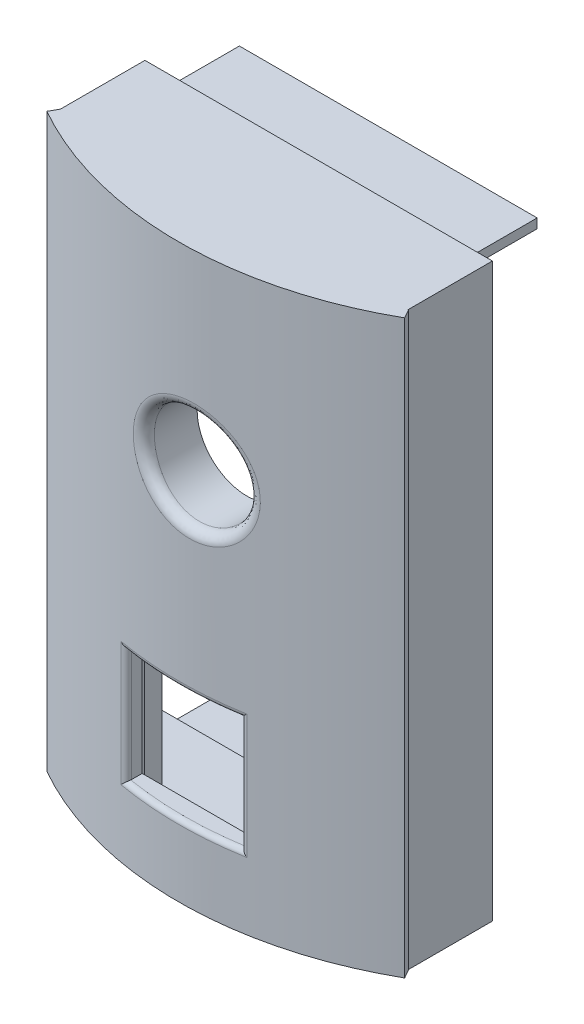
from build123d import *

# Parameters (mm, degrees)
SURFACE_EXTRUDE2_1_DEPTH = 115
THICKEN3_T2              = 2
BOSS_EXTRUDE2_REACH      = 890.669
SKETCH11_W               = 70
SKETCH11_H               = 115
SKETCH17_W               = 2.5
SKETCH17_H               = 115
BOSS_EXTRUDE8_DEPTH      = 17
SKETCH22_W               = 59.9
SKETCH22_H               = 1.9
BOSS_EXTRUDE9_DEPTH      = 31
SKETCH23_W               = 64.9
SKETCH23_H               = 2
BOSS_EXTRUDE10_DEPTH     = 17
SKETCH24_W               = 64.9
SKETCH24_H               = 3.5
BOSS_EXTRUDE11_DEPTH     = 17
SKETCH25_W               = 19
SKETCH25_H               = 1.3
BOSS_EXTRUDE12_DEPTH     = 14
SKETCH26_W               = 2.5
SKETCH26_H               = 55
CUT_EXTRUDE1_DEPTH       = 2.5
FILLET1_R                = 1
CUT_EXTRUDE2_REACH       = 891.139
CUT_EXTRUDE2_END_RADIUS  = 73
SKETCH27_R               = 10
CUT_EXTRUDE3_REACH       = 891.139
CUT_EXTRUDE3_END_RADIUS  = 73
SKETCH28_W               = 23
SKETCH28_H               = 23
SKETCH29_W               = 26
SKETCH29_H               = 34
CUT_EXTRUDE4_DEPTH       = 7
SKETCH30_W               = 29
SKETCH30_H               = 37
CUT_EXTRUDE5_DEPTH       = 5
FILLET2_R                = 2
FILLET4_R                = 1


with BuildPart() as body_1:
    # Surface-Extrude2: a surface, the sketch's curves swept straight by 115 mm
    with BuildLine(Plane(origin=(0, 0, 0), x_dir=(1, 0, 0), z_dir=(0, 1, 0)), mode=Mode.PRIVATE) as surface_extrude2_1_path:
        ThreePointArc((-880.139667207, 63.554736355), (-845.139667207, 54.328517201), (-810.139667207, 63.554736355))
    surface_extrude2_1 = Shell.extrude(surface_extrude2_1_path.wire(), (0 * SURFACE_EXTRUDE2_1_DEPTH, 1 * SURFACE_EXTRUDE2_1_DEPTH, 0 * SURFACE_EXTRUDE2_1_DEPTH))
    add(Solid.thicken(surface_extrude2_1, -THICKEN3_T2))

    # Sketch11 → Boss-Extrude2 (add, up to next)
    with BuildSketch(Plane(origin=(0, 0, -63.554736355), x_dir=(-1, 0, 0), z_dir=(0, 0, -1)), mode=Mode.PRIVATE) as boss_extrude2_sk1:
        with Locations((845.139667207, 57.5)):
            Rectangle(SKETCH11_W, SKETCH11_H)
    boss_extrude2_tool1 = extrude(boss_extrude2_sk1.sketch, amount=-BOSS_EXTRUDE2_REACH, mode=Mode.PRIVATE) - body_1.part
    add(boss_extrude2_tool1.solids().sort_by_distance((-845.139667, 57.5, -63.554736))[0])

    # Sketch17 → Boss-Extrude8 (add)
    with BuildSketch(Plane(origin=(0, 0, -63.554736355), x_dir=(-1, 0, 0), z_dir=(0, 0, -1))):
        with Locations((878.889667207, 57.5)):
            Rectangle(SKETCH17_W, SKETCH17_H)
        with Locations((811.489667207, 57.5)):
            Rectangle(SKETCH17_W, SKETCH17_H)
    extrude(amount=BOSS_EXTRUDE8_DEPTH)

    # Sketch22 → Boss-Extrude9 (add)
    with BuildSketch(Plane(origin=(0, 0, -63.554736355), x_dir=(-1, 0, 0), z_dir=(0, 0, -1))):
        with Locations((845.189667207, 112.05)):
            Rectangle(SKETCH22_W, SKETCH22_H)
    extrude(amount=BOSS_EXTRUDE9_DEPTH)

    # Sketch23 → Boss-Extrude10 (add)
    with BuildSketch(Plane(origin=(0, 0, -63.554736355), x_dir=(-1, 0, 0), z_dir=(0, 0, -1))):
        with Locations((845.189667207, 114)):
            Rectangle(SKETCH23_W, SKETCH23_H)
    extrude(amount=BOSS_EXTRUDE10_DEPTH)

    # Sketch24 → Boss-Extrude11 (add)
    with BuildSketch(Plane(origin=(0, 0, -63.554736355), x_dir=(-1, 0, 0), z_dir=(0, 0, -1))):
        with Locations((845.189667207, 1.75)):
            Rectangle(SKETCH24_W, SKETCH24_H)
    extrude(amount=BOSS_EXTRUDE11_DEPTH)

    # Sketch25 → Boss-Extrude12 (add)
    with BuildSketch(Plane(origin=(0, 0, -80.554736355), x_dir=(-1, 0, 0), z_dir=(0, 0, -1))):
        with Locations((865.139667207, 1.85)):
            Rectangle(SKETCH25_W, SKETCH25_H)
    extrude(amount=BOSS_EXTRUDE12_DEPTH)

    # Sketch26 → Cut-Extrude1 (cut)
    with BuildSketch(Plane.ZY.offset(880.139667207)):
        with Locations((-79.304736355, 35.5)):
            Rectangle(SKETCH26_W, SKETCH26_H)
    extrude(amount=-CUT_EXTRUDE1_DEPTH, mode=Mode.SUBTRACT)

    # Fillet1
    fillet1_edges = [body_1.edges().sort_by_distance(p)[0] for p in [
        (-845.189667207, 111.1, -63.554736355),
        (-813.989667207, 113, -63.554736355),
        (-812.739667207, 113, -72.054736355),
        (-876.389667207, 113, -63.554736355),
        (-877.639667207, 113, -72.054736355),
        (-812.739667207, 58.25, -63.554736355),
        (-877.639667207, 58.25, -63.554736355),
        (-845.189667207, 3.5, -63.554736355),
        (-877.639667207, 3.5, -72.054736355),
        (-812.739667207, 3.5, -72.054736355),
    ]]
    fillet(fillet1_edges, radius=FILLET1_R)

    # Cut-Extrude2: up to this cylinder (the profile starts inside it)
    cut_extrude2_end = Plane(origin=(-845.139667207, 76.35, -125.328517201), z_dir=(0, 1, 0)) * Cylinder(CUT_EXTRUDE2_END_RADIUS, 1929.278, mode=Mode.PRIVATE)
    # Sketch27 → Cut-Extrude2 (cut, up to the surface)
    with BuildSketch(Plane(origin=(0, 0, -63.554736355), x_dir=(-1, 0, 0), z_dir=(0, 0, -1)), mode=Mode.PRIVATE) as cut_extrude2_sk1:
        with Locations((842.639667207, 76.35)):
            Circle(SKETCH27_R)
    cut_extrude2_tool1 = extrude(cut_extrude2_sk1.sketch, amount=-CUT_EXTRUDE2_REACH, mode=Mode.PRIVATE) & cut_extrude2_end
    add(cut_extrude2_tool1.solids().sort_by_distance((-842.639667, 76.35, -63.554736))[0], mode=Mode.SUBTRACT)

    # Cut-Extrude3: up to this cylinder (the profile starts inside it)
    cut_extrude3_end = Plane(origin=(-845.139667207, 26, -125.328517201), z_dir=(0, 1, 0)) * Cylinder(CUT_EXTRUDE3_END_RADIUS, 1929.278, mode=Mode.PRIVATE)
    # Sketch28 → Cut-Extrude3 (cut, up to the surface)
    with BuildSketch(Plane(origin=(0, 0, -63.554736355), x_dir=(-1, 0, 0), z_dir=(0, 0, -1)), mode=Mode.PRIVATE) as cut_extrude3_sk1:
        with Locations((845.189667207, 26)):
            Rectangle(SKETCH28_W, SKETCH28_H)
    cut_extrude3_tool1 = extrude(cut_extrude3_sk1.sketch, amount=-CUT_EXTRUDE3_REACH, mode=Mode.PRIVATE) & cut_extrude3_end
    add(cut_extrude3_tool1.solids().sort_by_distance((-845.189667, 26, -63.554736))[0], mode=Mode.SUBTRACT)

    # Sketch29 → Cut-Extrude4 (cut)
    with BuildSketch(Plane(origin=(0, 0, -63.554736355), x_dir=(-1, 0, 0), z_dir=(0, 0, -1))):
        with Locations((845.189667207, 26)):
            Rectangle(SKETCH29_W, SKETCH29_H)
    extrude(amount=-CUT_EXTRUDE4_DEPTH, mode=Mode.SUBTRACT)

    # Sketch30 → Cut-Extrude5 (cut)
    with BuildSketch(Plane(origin=(0, 0, -63.554736355), x_dir=(-1, 0, 0), z_dir=(0, 0, -1))):
        with Locations((845.189667207, 26)):
            Rectangle(SKETCH30_W, SKETCH30_H)
    extrude(amount=-CUT_EXTRUDE5_DEPTH, mode=Mode.SUBTRACT)

    # Fillet2
    fillet2_edges = [body_1.edges().sort_by_distance(p)[0] for p in [
        (-832.639667207, 76.35, -53.406684633),
    ]]
    fillet(fillet2_edges, radius=FILLET2_R)

    # Fillet4
    # the kernel refuses this fillet: 1 mm, written as the material it takes off along each edge
    with BuildSketch(Plane(origin=(-845.139667207, 37.5, -125.328517201), x_dir=(0.1905739721044278, 0, 0.9816728381473843), z_dir=(0.9816728381473843, 0, -0.1905739721044278))) as fillet4_piece_1_section:
        with BuildLine():
            CenterArc((73 - FILLET4_R, -FILLET4_R), FILLET4_R, 360, 90)
            Line((73 - FILLET4_R, 0), (73, 0))
            Line((73, 0), (73, -FILLET4_R))
        make_face()
    fillet4_piece_1 = revolve(axis=Axis((-845.139667207, 37.5, -125.328517201), (0, -1, 0)), revolution_arc=22.052044681, mode=Mode.PRIVATE)
    fillet4_piece_1 = split(fillet4_piece_1, bisect_by=Plane(origin=(-856.689667207, 37.780123438, -52.608658633), z_dir=(1, 0, 0)), keep=Keep.TOP, mode=Mode.PRIVATE)
    fillet4_piece_1 = split(fillet4_piece_1, bisect_by=Plane(origin=(-833.689667207, 37.780123438, -52.608658633), z_dir=(-1, 0, 0)), keep=Keep.TOP, mode=Mode.PRIVATE)
    add(fillet4_piece_1, mode=Mode.SUBTRACT)
    with BuildSketch(Plane(origin=(-845.139667207, 14.5, -125.328517201), x_dir=(0.1905739721044278, 0, 0.9816728381473843), z_dir=(0.9816728381473843, 0, -0.1905739721044278))) as fillet4_piece_2_section:
        with BuildLine():
            CenterArc((73 - FILLET4_R, FILLET4_R), FILLET4_R, 270, 90)
            Line((73 - FILLET4_R, 0), (73, 0))
            Line((73, 0), (73, FILLET4_R))
        make_face()
    fillet4_piece_2 = revolve(axis=Axis((-845.139667207, 14.5, -125.328517201), (0, -1, 0)), revolution_arc=22.052044681, mode=Mode.PRIVATE)
    fillet4_piece_2 = split(fillet4_piece_2, bisect_by=Plane(origin=(-856.689667207, 14.219876562, -52.608658633), z_dir=(1, 0, 0)), keep=Keep.TOP, mode=Mode.PRIVATE)
    fillet4_piece_2 = split(fillet4_piece_2, bisect_by=Plane(origin=(-833.689667207, 14.219876562, -52.608658633), z_dir=(-1, 0, 0)), keep=Keep.TOP, mode=Mode.PRIVATE)
    add(fillet4_piece_2, mode=Mode.SUBTRACT)
    with BuildSketch(Plane(origin=(-833.689667207, 14.5, -53.23207138), x_dir=(0.9863122201190242, 0, -0.1648884606146883), z_dir=(0, 1, 0))) as fillet4_piece_3:
        with BuildLine():
            CenterArc((1.181048929, 0.999966828), FILLET4_R, 170.509245018, 99.957443722)
            Line((0.194736709, 1.164855288), (0, 0))
            ThreePointArc((0, 0), (0.594597047, -0.002421586), (1.189194094, 0))
        make_face()
    extrude(amount=23, mode=Mode.SUBTRACT)
    with BuildSketch(Plane(origin=(-856.689667207, 14.5, -53.248024001), x_dir=(-0.9860806184572719, 0, -0.16626789799274064), z_dir=(0, 1, 0))) as fillet4_piece_4:
        with BuildLine():
            CenterArc((1.18272517, -0.999966733), FILLET4_R, 89.532648883, 100.038248275)
            Line((0.196644551, -1.166234631), (0, 0))
            ThreePointArc((0, 0), (0.595440948, 0.002428465), (1.190881895, 0))
        make_face()
    extrude(amount=23, mode=Mode.SUBTRACT)
    with BuildSketch(Plane(origin=(-845.139667207, 37.5, -125.328517201), x_dir=(0.1905739721044278, 0, 0.9816728381473843), z_dir=(0.9816728381473843, 0, -0.1905739721044278))) as fillet4_piece_5a_section:
        with BuildLine():
            CenterArc((73 - FILLET4_R, -FILLET4_R), FILLET4_R, 360, 90)
            Line((73 - FILLET4_R, 0), (73, 0))
            Line((73, 0), (73, -FILLET4_R))
        make_face()
    fillet4_piece_5a = revolve(axis=Axis((-845.139667207, 37.5, -125.328517201), (0, -1, 0)), revolution_arc=22.052044681, mode=Mode.PRIVATE)
    fillet4_piece_5a = split(fillet4_piece_5a, bisect_by=Plane(origin=(-833.689667207, 37.728553256, -53.664532425), z_dir=(1, 0, 0)), keep=Keep.TOP, mode=Mode.PRIVATE)
    with BuildSketch(Plane(origin=(-833.689667207, 14.5, -53.23207138), x_dir=(0.9863122201190242, 0, -0.1648884606146883), z_dir=(0, 1, 0))) as fillet4_piece_5b_section:
        with BuildLine():
            CenterArc((1.181048929, 0.999966828), FILLET4_R, 170.509245018, 99.957443722)
            Line((0.194736709, 1.164855288), (0, 0))
            ThreePointArc((0, 0), (0.594597047, -0.002421586), (1.189194094, 0))
        make_face()
    fillet4_piece_5b = extrude(amount=25.972985234, mode=Mode.PRIVATE)
    fillet4_piece_5b = split(fillet4_piece_5b, bisect_by=Plane(origin=(-833.418094494, 37.5, -53.549021216), z_dir=(0, 1, 0)), keep=Keep.TOP, mode=Mode.PRIVATE)
    fillet4_piece_5 = fillet4_piece_5a & fillet4_piece_5b
    add(fillet4_piece_5, mode=Mode.SUBTRACT)
    with BuildSketch(Plane(origin=(-856.689667207, 14.5, -53.248024001), x_dir=(-0.9860806184572719, 0, -0.16626789799274064), z_dir=(0, 1, 0))) as fillet4_piece_6a_section:
        with BuildLine():
            CenterArc((1.18272517, -0.999966733), FILLET4_R, 89.532648883, 100.038248275)
            Line((0.196644551, -1.166234631), (0, 0))
            ThreePointArc((0, 0), (0.595440948, 0.002428465), (1.190881895, 0))
        make_face()
    fillet4_piece_6a = extrude(amount=25.977204738, mode=Mode.PRIVATE)
    fillet4_piece_6a = split(fillet4_piece_6a, bisect_by=Plane(origin=(-856.961615044, 37.5, -53.56586373), z_dir=(0, 1, 0)), keep=Keep.TOP, mode=Mode.PRIVATE)
    with BuildSketch(Plane(origin=(-845.139667207, 37.5, -125.328517201), x_dir=(0.1905739721044278, 0, 0.9816728381473843), z_dir=(0.9816728381473843, 0, -0.1905739721044278))) as fillet4_piece_6b_section:
        with BuildLine():
            CenterArc((73 - FILLET4_R, -FILLET4_R), FILLET4_R, 360, 90)
            Line((73 - FILLET4_R, 0), (73, 0))
            Line((73, 0), (73, -FILLET4_R))
        make_face()
    fillet4_piece_6b = revolve(axis=Axis((-845.139667207, 37.5, -125.328517201), (0, -1, 0)), revolution_arc=22.052044681, mode=Mode.PRIVATE)
    fillet4_piece_6b = split(fillet4_piece_6b, bisect_by=Plane(origin=(-856.689667207, 37.728569527, -53.682163733), z_dir=(-1, 0, 0)), keep=Keep.TOP, mode=Mode.PRIVATE)
    fillet4_piece_6 = fillet4_piece_6a & fillet4_piece_6b
    add(fillet4_piece_6, mode=Mode.SUBTRACT)
    with BuildSketch(Plane(origin=(-845.139667207, 14.5, -125.328517201), x_dir=(0.1905739721044278, 0, 0.9816728381473843), z_dir=(0.9816728381473843, 0, -0.1905739721044278))) as fillet4_piece_7a_section:
        with BuildLine():
            CenterArc((73 - FILLET4_R, FILLET4_R), FILLET4_R, 270, 90)
            Line((73 - FILLET4_R, 0), (73, 0))
            Line((73, 0), (73, FILLET4_R))
        make_face()
    fillet4_piece_7a = revolve(axis=Axis((-845.139667207, 14.5, -125.328517201), (0, -1, 0)), revolution_arc=22.052044681, mode=Mode.PRIVATE)
    fillet4_piece_7a = split(fillet4_piece_7a, bisect_by=Plane(origin=(-833.689667207, 14.271446728, -53.664532423), z_dir=(1, 0, 0)), keep=Keep.TOP, mode=Mode.PRIVATE)
    with BuildSketch(Plane(origin=(-833.689667207, 11.527014766, -53.23207138), x_dir=(0.9863122201190255, 0, -0.16488846061468057), z_dir=(0, 1, 0))) as fillet4_piece_7b_section:
        with BuildLine():
            CenterArc((1.181048929, 0.999966828), FILLET4_R, 170.509245018, 99.957443722)
            Line((0.194736709, 1.164855288), (0, 0))
            ThreePointArc((0, 0), (0.594597047, -0.002421586), (1.189194094, 0))
        make_face()
    fillet4_piece_7b = extrude(amount=25.972985234, mode=Mode.PRIVATE)
    fillet4_piece_7b = split(fillet4_piece_7b, bisect_by=Plane(origin=(-833.418094494, 14.5, -53.549021216), z_dir=(0, -1, 0)), keep=Keep.TOP, mode=Mode.PRIVATE)
    fillet4_piece_7 = fillet4_piece_7a & fillet4_piece_7b
    add(fillet4_piece_7, mode=Mode.SUBTRACT)
    with BuildSketch(Plane(origin=(-845.139667207, 14.5, -125.328517201), x_dir=(0.1905739721044278, 0, 0.9816728381473843), z_dir=(0.9816728381473843, 0, -0.1905739721044278))) as fillet4_piece_8a_section:
        with BuildLine():
            CenterArc((73 - FILLET4_R, FILLET4_R), FILLET4_R, 270, 90)
            Line((73 - FILLET4_R, 0), (73, 0))
            Line((73, 0), (73, FILLET4_R))
        make_face()
    fillet4_piece_8a = revolve(axis=Axis((-845.139667207, 14.5, -125.328517201), (0, -1, 0)), revolution_arc=22.052044681, mode=Mode.PRIVATE)
    fillet4_piece_8a = split(fillet4_piece_8a, bisect_by=Plane(origin=(-856.689667207, 14.27143049, -53.682163735), z_dir=(-1, 0, 0)), keep=Keep.TOP, mode=Mode.PRIVATE)
    with BuildSketch(Plane(origin=(-856.689667207, 11.522795262, -53.248024001), x_dir=(-0.9860806184572763, 0, -0.16626789799271335), z_dir=(0, 1, 0))) as fillet4_piece_8b_section:
        with BuildLine():
            CenterArc((1.18272517, -0.999966733), FILLET4_R, 89.532648883, 100.038248275)
            Line((0.196644551, -1.166234631), (0, 0))
            ThreePointArc((0, 0), (0.595440948, 0.002428465), (1.190881895, 0))
        make_face()
    fillet4_piece_8b = extrude(amount=25.977204738, mode=Mode.PRIVATE)
    fillet4_piece_8b = split(fillet4_piece_8b, bisect_by=Plane(origin=(-856.961615044, 14.5, -53.56586373), z_dir=(0, -1, 0)), keep=Keep.TOP, mode=Mode.PRIVATE)
    fillet4_piece_8 = fillet4_piece_8a & fillet4_piece_8b
    add(fillet4_piece_8, mode=Mode.SUBTRACT)


solid = body_1.part
